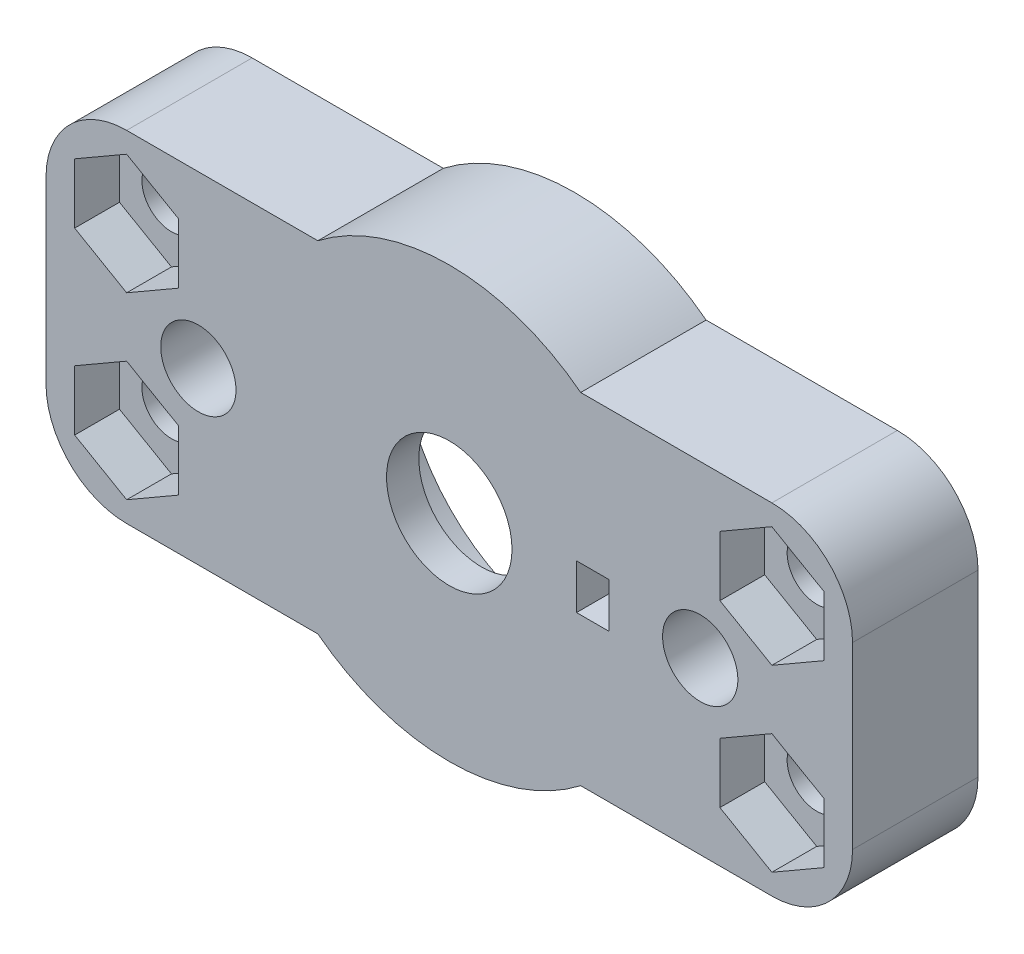
from build123d import *

# Parameters (mm, degrees)
SKETCH2_R           = 1.65
BOSS_EXTRUDE1_DEPTH = 7
SKETCH3_R           = 9.7
CUT_EXTRUDE1_DEPTH  = 5
SKETCH4_R           = 7.5
CUT_EXTRUDE2_DEPTH  = 5
CUT_EXTRUDE3_DEPTH  = 2.5
BOSS_EXTRUDE2_START = -1.8
SKETCH6_R           = 7.5
SKETCH6_R_2         = 3.5
BOSS_EXTRUDE2_DEPTH = 1.8
SKETCH7_W           = 1.8
SKETCH7_H           = 2.5
CUT_EXTRUDE4_DEPTH  = 2.5
SKETCH8_R           = 2.1
CUT_EXTRUDE5_DEPTH  = 3


with BuildPart() as part:
    # Sketch2 → Boss-Extrude1 (new body)
    with BuildSketch(Plane.XY):
        with BuildLine():
            Line((-18, 9.5), (-7.331439149, 9.5))
            ThreePointArc((-7.331439149, 9.5), (0, 12), (7.331439149, 9.5))
            Line((7.331439149, 9.5), (18, 9.5))
            ThreePointArc((18, 9.5), (21.181980515, 8.181980515), (22.5, 5))
            Line((22.5, 5), (22.5, -5))
            ThreePointArc((22.5, -5), (21.181980515, -8.181980515), (18, -9.5))
            Line((18, -9.5), (7.331439149, -9.5))
            ThreePointArc((7.331439149, -9.5), (0, -12), (-7.331439149, -9.5))
            Line((-7.331439149, -9.5), (-18, -9.5))
            ThreePointArc((-18, -9.5), (-21.181980515, -8.181980515), (-22.5, -5))
            Line((-22.5, -5), (-22.5, 5))
            ThreePointArc((-22.5, 5), (-21.181980515, 8.181980515), (-18, 9.5))
        make_face()
        with Locations((-18, 5)):
            Circle(SKETCH2_R, mode=Mode.SUBTRACT)
        with Locations((18, 5)):
            Circle(SKETCH2_R, mode=Mode.SUBTRACT)
        with Locations((18, -5)):
            Circle(SKETCH2_R, mode=Mode.SUBTRACT)
        with Locations((-18, -5)):
            Circle(SKETCH2_R, mode=Mode.SUBTRACT)
    extrude(amount=BOSS_EXTRUDE1_DEPTH)

    # Sketch3 → Cut-Extrude1 (cut)
    with BuildSketch(Plane.XY):
        Circle(SKETCH3_R)
    extrude(amount=CUT_EXTRUDE1_DEPTH, mode=Mode.SUBTRACT)

    # Sketch4 → Cut-Extrude2 (cut)
    with BuildSketch(Plane(origin=(0, 0, 5), x_dir=(-1, 0, 0), z_dir=(0, 0, -1))):
        Circle(SKETCH4_R)
    extrude(amount=-CUT_EXTRUDE2_DEPTH, mode=Mode.SUBTRACT)

    # Sketch5 → Cut-Extrude3 (cut)
    with BuildSketch(Plane.XY.offset(7)):
        Polygon((-18, 8.348631561), (-20.9, 6.674315781), (-20.9, 3.325684219), (-18, 1.651368439), (-15.1, 3.325684219), (-15.1, 6.674315781), align=None)
        Polygon((15.1, 6.674315781), (18, 8.348631561), (20.9, 6.674315781), (20.9, 3.325684219), (18, 1.651368439), (15.1, 3.325684219), align=None)
        Polygon((15.1, -3.325684219), (15.1, -6.674315781), (18, -8.348631561), (20.9, -6.674315781), (20.9, -3.325684219), (18, -1.651368439), align=None)
        Polygon((-15.1, -6.674315781), (-18, -8.348631561), (-20.9, -6.674315781), (-20.9, -3.325684219), (-18, -1.651368439), (-15.1, -3.325684219), align=None)
    extrude(amount=-CUT_EXTRUDE3_DEPTH, mode=Mode.SUBTRACT)

    # Sketch6 → Boss-Extrude2 (add)
    with BuildSketch(Plane.XY.offset(7).offset(BOSS_EXTRUDE2_START)):
        Circle(SKETCH6_R)
        Circle(SKETCH6_R_2, mode=Mode.SUBTRACT)
    extrude(amount=BOSS_EXTRUDE2_DEPTH)

    # Sketch7 → Cut-Extrude4 (cut)
    with BuildSketch(Plane.XY.offset(7)):
        with Locations((8, 0)):
            Rectangle(SKETCH7_W, SKETCH7_H)
    extrude(amount=-CUT_EXTRUDE4_DEPTH, mode=Mode.SUBTRACT)

    # Sketch8 → Cut-Extrude5 (cut)
    with BuildSketch(Plane.XY.offset(7)):
        with Locations((-14, 0)):
            Circle(SKETCH8_R)
        with Locations((14, 0)):
            Circle(SKETCH8_R)
    extrude(amount=-CUT_EXTRUDE5_DEPTH, mode=Mode.SUBTRACT)


solid = part.part
